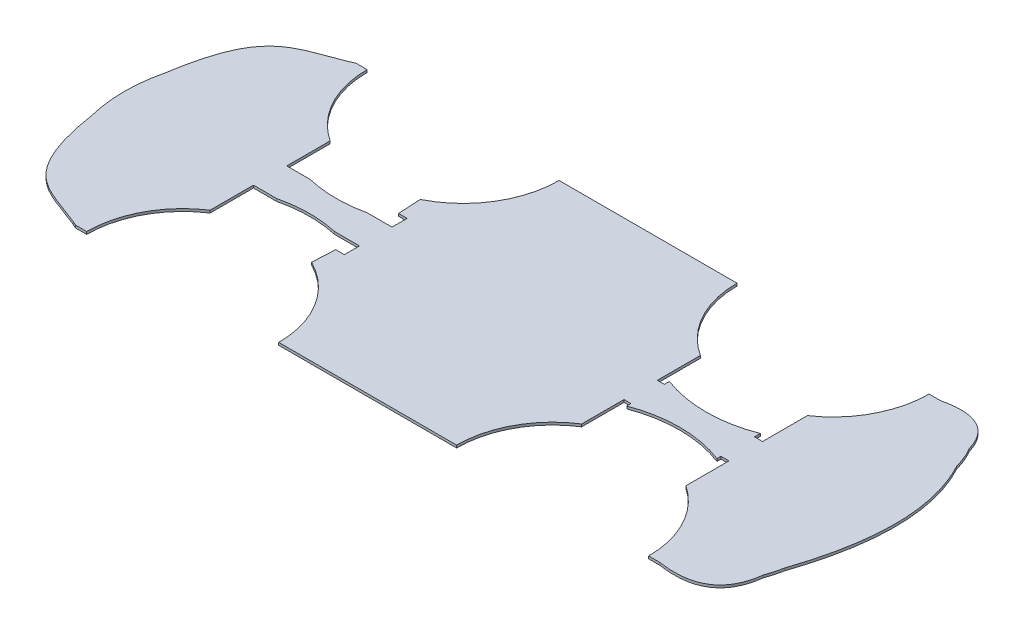
from build123d import *

# Parameters (mm, degrees)
SKETCH1_W            = 581.25
SKETCH1_H            = 236.875
BOSS_EXTRUDE1_DEPTH  = 5
SKETCH2_W            = 581.25
SKETCH2_H            = 5
BOSS_EXTRUDE2_DEPTH  = 41.35
CUT_EXTRUDE4_DEPTH   = 628.683302411
SKETCH4_W            = 290.625
SKETCH4_H            = 139.1125
CUT_EXTRUDE8_DEPTH   = 628.683302411
SKETCH7_W            = 0.7
SKETCH7_H            = 139.1125
CUT_EXTRUDE9_DEPTH   = 590.435381451
BOSS_EXTRUDE8_START  = -5
BOSS_EXTRUDE8_DEPTH  = 5
CUT_EXTRUDE14_START  = -6
CUT_EXTRUDE14_DEPTH  = 7
SKETCH10_W           = 88.237732613
SKETCH10_H           = 139.1125
CUT_EXTRUDE15_DEPTH  = 690.954958212
CUT_EXTRUDE16_DEPTH  = 694.925451462
CUT_EXTRUDE17_DEPTH  = 694.925451462
CUT_EXTRUDE18_DEPTH  = 694.925451462
CUT_EXTRUDE19_DEPTH  = 694.925451462
BOSS_EXTRUDE10_DEPTH = 5
BOSS_EXTRUDE13_START = -5
BOSS_EXTRUDE13_DEPTH = 5
CUT_EXTRUDE24_START  = -10
CUT_EXTRUDE24_DEPTH  = 10
BOSS_EXTRUDE16_DEPTH = 5
BOSS_EXTRUDE19_DEPTH = 5
BOSS_EXTRUDE20_START = -5
BOSS_EXTRUDE20_DEPTH = 5
BOSS_EXTRUDE21_START = -5
BOSS_EXTRUDE21_DEPTH = 5
BOSS_EXTRUDE22_START = -5
BOSS_EXTRUDE22_DEPTH = 5
BOSS_EXTRUDE23_START = -5
BOSS_EXTRUDE23_DEPTH = 5
CUT_EXTRUDE25_START  = -6
CUT_EXTRUDE25_DEPTH  = 7
SKETCH29_W           = 5
SKETCH29_H           = 5
CUT_EXTRUDE26_DEPTH  = 20
CUT_EXTRUDE27_START  = -6
CUT_EXTRUDE27_DEPTH  = 7
CUT_EXTRUDE28_START  = -6
CUT_EXTRUDE28_DEPTH  = 7
CUT_EXTRUDE29_DEPTH  = 2.5


with BuildPart() as part:
    # Sketch1 → Boss-Extrude1 (new body)
    with BuildSketch(Plane(origin=(0, 0, 0), x_dir=(1, 0, 0), z_dir=(0, 1, 0))):
        with Locations((290.625, 118.4375)):
            Rectangle(SKETCH1_W, SKETCH1_H)
    extrude(amount=BOSS_EXTRUDE1_DEPTH)

    # Sketch2 → Boss-Extrude2 (add)
    with BuildSketch(Plane.XY):
        with Locations((290.625, 2.5)):
            Rectangle(SKETCH2_W, SKETCH2_H)
    extrude(amount=BOSS_EXTRUDE2_DEPTH)

    # Sketch3 → Cut-Extrude4 (cut, through all)
    with BuildSketch(Plane(origin=(0, 5, 0), x_dir=(1, 0, 0), z_dir=(0, 1, 0))):
        with BuildLine():
            Line((561.288662792, -1.35), (388.367199859, -1.35))
            ThreePointArc((388.367199859, -1.35), (387.060651643, -4.30458594), (385.855034537, -7.301773574))
            Line((385.855034537, -7.301773574), (423.825, -41.35))
            Line((423.825, -41.35), (474.827931326, -41.35))
            Line((474.827931326, -41.35), (525.825, -41.35))
            Line((525.825, -41.35), (564.419690988, -8.965209027))
            ThreePointArc((564.419690988, -8.965209027), (562.936488006, -5.12376192), (561.288662792, -1.35))
        make_face()
        with BuildLine():
            Line((475.714581985, 20.289198365), (402.191388797, 20.289198365))
            ThreePointArc((402.191388797, 20.289198365), (394.546866468, 9.937510283), (388.367199859, -1.35))
            Line((388.367199859, -1.35), (561.288662792, -1.35))
            ThreePointArc((561.288662792, -1.35), (555.108996184, 9.937510283), (547.464473855, 20.289198365))
            Line((547.464473855, 20.289198365), (475.714581985, 20.289198365))
        make_face()
        with BuildLine():
            ThreePointArc((547.464473855, 20.289198365), (474.827931326, 53.915198712), (402.191388797, 20.289198365))
            Line((402.191388797, 20.289198365), (475.714581985, 20.289198365))
            Line((475.714581985, 20.289198365), (547.464473855, 20.289198365))
        make_face()
        with BuildLine():
            ThreePointArc((385.855034537, -7.301773574), (381.149014866, -24.037614359), (379.562732613, -41.35))
            Line((379.562732613, -41.35), (404.745509672, -41.35))
            Line((404.745509672, -41.35), (423.825, -41.35))
            Line((423.825, -41.35), (385.855034537, -7.301773574))
        make_face()
        with BuildLine():
            Line((546.683654297, -41.35), (570.093130038, -41.35))
            ThreePointArc((570.093130038, -41.35), (568.664051431, -24.911002182), (564.419690988, -8.965209027))
            Line((564.419690988, -8.965209027), (525.825, -41.35))
            Line((525.825, -41.35), (546.683654297, -41.35))
        make_face()
    extrude(amount=-CUT_EXTRUDE4_DEPTH, mode=Mode.SUBTRACT)

    # Sketch4 → Cut-Extrude8 (cut, through all)
    with BuildSketch(Plane(origin=(0, 5, 0), x_dir=(1, 0, 0), z_dir=(0, 1, 0))):
        with Locations((435.9375, 167.31875)):
            Rectangle(SKETCH4_W, SKETCH4_H)
        with Locations((145.3125, 28.20625)):
            Rectangle(SKETCH4_W, SKETCH4_H)
        with Locations((145.3125, 167.31875)):
            Rectangle(SKETCH4_W, SKETCH4_H)
    extrude(amount=-CUT_EXTRUDE8_DEPTH, mode=Mode.SUBTRACT)

    # Sketch7 → Cut-Extrude9 (cut, through all)
    with BuildSketch(Plane(origin=(0, 5, 0), x_dir=(1, 0, 0), z_dir=(0, 1, 0))):
        with Locations((290.975, 28.20625)):
            Rectangle(SKETCH7_W, SKETCH7_H)
    extrude(amount=-CUT_EXTRUDE9_DEPTH, mode=Mode.SUBTRACT)

    # Mirror11: part across plane


with BuildPart() as part_1:
    add(part.part)
    add(part.part.mirror(Plane(origin=(0, 0, -97.7625), x_dir=(1, 0, 0), z_dir=(0, 0, -1))))

    # Mirror12: part across plane


with BuildPart() as part_2:
    add(part_1.part)
    add(part_1.part.mirror(Plane.ZY.offset(-291.325)))

    # Boss-Extrude8: read off the stored shape, not the designer's step
    # Boss-Extrude8 outline → Boss-Extrude8 (add)
    with BuildSketch(Plane(origin=(0, 5, 0), x_dir=(1, 0, 0), z_dir=(0, 1, 0)).offset(BOSS_EXTRUDE8_START)):
        with BuildLine():
            Line((581.25, 236.875), (581.25, -41.35))
            ThreePointArc((581.25, -41.35), (647.999289148, 97.7625), (581.25, 236.875))
        make_face()
        with BuildLine():
            Line((1.4, -41.35), (1.4, 236.875))
            ThreePointArc((1.4, 236.875), (-69.575242199, 97.7625), (1.4, -41.35))
        make_face()
    extrude(amount=BOSS_EXTRUDE8_DEPTH)

    # Cut-Extrude14: read off the stored shape, not the designer's step
    # Cut-Extrude14 outline → Cut-Extrude14 (cut)
    with BuildSketch(Plane(origin=(0, 0, 0), x_dir=(-1, 0, 0), z_dir=(0, -1, 0)).offset(CUT_EXTRUDE14_START)):
        with BuildLine():
            ThreePointArc((-62.383549112, 76.236492902), (-107.27373879, 84.709278545), (-152.235937883, 76.627330852))
            ThreePointArc((-152.235937883, 76.627330852), (-150.454986439, 61.039222908), (-143.430617126, 47.009998658))
            ThreePointArc((-143.430617126, 47.009998658), (-107.407690123, 53.914297489), (-71.446189441, 46.696882373))
            ThreePointArc((-71.446189441, 46.696882373), (-64.300040219, 60.664468013), (-62.383549112, 76.236492902))
        make_face()
    extrude(amount=CUT_EXTRUDE14_DEPTH, mode=Mode.SUBTRACT)

    # Sketch10 → Cut-Extrude15 (cut, through all)
    with BuildSketch(Plane(origin=(0, 0, 0), x_dir=(-1, 0, 0), z_dir=(0, -1, 0))):
        with Locations((-335.443866307, 28.20625)):
            Rectangle(SKETCH10_W, SKETCH10_H)
        with BuildLine():
            ThreePointArc((-570.093130038, -41.35), (-474.827931326, 53.915198712), (-379.562732613, -41.35))
            Line((-379.562732613, -41.35), (-379.562732613, 97.7625))
            Line((-379.562732613, 97.7625), (-647.999289148, 97.7625))
            ThreePointArc((-647.999289148, 97.7625), (-630.448332788, 20.613690453), (-581.25, -41.35))
            Line((-581.25, -41.35), (-570.093130038, -41.35))
        make_face()
        with Locations((-335.443866307, 167.31875)):
            Rectangle(SKETCH10_W, SKETCH10_H)
        with BuildLine():
            Line((-291.325, 236.875), (-291.325, 97.7625))
            Line((-291.325, 97.7625), (69.575242199, 97.7625))
            ThreePointArc((69.575242199, 97.7625), (50.80630243, 175.848626587), (-1.4, 236.875))
            Line((-1.4, 236.875), (-12.556869962, 236.875))
            ThreePointArc((-12.556869962, 236.875), (-107.822068674, 141.609801288), (-203.087267387, 236.875))
            Line((-203.087267387, 236.875), (-291.325, 236.875))
        make_face()
        with BuildLine():
            Line((-647.999289148, 97.7625), (-379.562732613, 97.7625))
            Line((-379.562732613, 97.7625), (-379.562732613, 236.875))
            ThreePointArc((-379.562732613, 236.875), (-474.827931326, 141.609801288), (-570.093130038, 236.875))
            Line((-570.093130038, 236.875), (-581.25, 236.875))
            ThreePointArc((-581.25, 236.875), (-630.448332788, 174.911309547), (-647.999289148, 97.7625))
        make_face()
    extrude(amount=-CUT_EXTRUDE15_DEPTH, mode=Mode.SUBTRACT)

    # Mirror13: part across plane


with BuildPart() as part_3:
    add(part_2.part)
    add(part_2.part.mirror(Plane(origin=(0, 0, -97.7625), x_dir=(1, 0, 0), z_dir=(0, 0, -1))))

    # Mirror14: part across plane


with BuildPart() as part_4:
    add(part_3.part)
    add(part_3.part.mirror(Plane.ZY.offset(-291.325)))

    # Sketch11 → Cut-Extrude16 (cut, through all)
    with BuildSketch(Plane(origin=(0, 0, 0), x_dir=(-1, 0, 0), z_dir=(0, -1, 0))):
        Polygon((-430.414062117, 118.897669148), (-432.166884114, 151.69581747), (-517.488978538, 151.69581747), (-520.266450888, 119.288507098), align=None)
    extrude(amount=-CUT_EXTRUDE16_DEPTH, mode=Mode.SUBTRACT)

    # Sketch12 → Cut-Extrude17 (cut, through all)
    with BuildSketch(Plane(origin=(0, 0, 0), x_dir=(-1, 0, 0), z_dir=(0, -1, 0))):
        with BuildLine():
            Line((-291.325, -41.35), (-291.325, 97.7625))
            Line((-291.325, 97.7625), (-652.225242199, 97.7625))
            ThreePointArc((-652.225242199, 97.7625), (-633.45630243, 19.676373413), (-581.25, -41.35))
            Line((-581.25, -41.35), (-570.093130038, -41.35))
            ThreePointArc((-570.093130038, -41.35), (-554.01383111, 11.612735589), (-511.203810559, 46.696882374))
            ThreePointArc((-511.203810559, 46.696882374), (-518.349959781, 60.664468013), (-520.266450888, 76.236492902))
            ThreePointArc((-520.266450888, 76.236492902), (-475.37626121, 84.709278545), (-430.414062117, 76.627330852))
            ThreePointArc((-430.414062117, 76.627330852), (-432.195013561, 61.039222908), (-439.219382874, 47.009998658))
            ThreePointArc((-439.219382874, 47.009998658), (-395.873154619, 11.956672385), (-379.562732613, -41.35))
            Line((-379.562732613, -41.35), (-291.325, -41.35))
        make_face()
        with BuildLine():
            Line((-203.087267387, 236.875), (-291.325, 236.875))
            Line((-291.325, 236.875), (-291.325, 97.7625))
            Line((-291.325, 97.7625), (-291.325, -41.35))
            Line((-291.325, -41.35), (-203.087267387, -41.35))
            ThreePointArc((-203.087267387, -41.35), (-186.776845381, 11.956672385), (-143.430617126, 47.009998658))
            ThreePointArc((-143.430617126, 47.009998658), (-150.454986439, 61.039222908), (-152.235937883, 76.627330852))
            ThreePointArc((-152.235937883, 76.627330852), (-107.27373879, 84.709278545), (-62.383549112, 76.236492902))
            ThreePointArc((-62.383549112, 76.236492902), (-64.300040219, 60.664468013), (-71.446189441, 46.696882374))
            ThreePointArc((-71.446189441, 46.696882374), (-28.63616889, 11.612735589), (-12.556869962, -41.35))
            Line((-12.556869962, -41.35), (-1.4, -41.35))
            ThreePointArc((-1.4, -41.35), (69.575242199, 97.7625), (-1.4, 236.875))
            Line((-1.4, 236.875), (-12.556869962, 236.875))
            ThreePointArc((-12.556869962, 236.875), (-28.63616889, 183.912264411), (-71.446189441, 148.828117626))
            ThreePointArc((-71.446189441, 148.828117626), (-64.300040219, 134.860531987), (-62.383549112, 119.288507098))
            ThreePointArc((-62.383549112, 119.288507098), (-107.27373879, 110.815721455), (-152.235937883, 118.897669148))
            ThreePointArc((-152.235937883, 118.897669148), (-150.454986439, 134.485777092), (-143.430617126, 148.515001342))
            ThreePointArc((-143.430617126, 148.515001342), (-186.776845381, 183.568327615), (-203.087267387, 236.875))
        make_face()
    extrude(amount=-CUT_EXTRUDE17_DEPTH, mode=Mode.SUBTRACT)

    # Mirror15: part across plane


with BuildPart() as part_5:
    add(part_4.part)
    add(part_4.part.mirror(Plane(origin=(0, 0, -97.7625), x_dir=(1, 0, 0), z_dir=(0, 0, -1))))

    # Mirror16: part across plane


with BuildPart() as part_6:
    add(part_5.part)
    add(part_5.part.mirror(Plane.ZY.offset(-291.325)))

    # Sketch13 → Cut-Extrude18 (cut, through all)
    with BuildSketch(Plane(origin=(0, 0, 0), x_dir=(-1, 0, 0), z_dir=(0, -1, 0))):
        with BuildLine():
            Line((-291.325, 97.7625), (-410.414062117, 97.7625))
            Line((-410.414062117, 97.7625), (-410.414062117, 53.917273781))
            ThreePointArc((-410.414062117, 53.917273781), (-378.354190748, 21.242470624), (-361.580414797, -21.35))
            Line((-361.580414797, -21.35), (-291.325, -21.35))
            Line((-291.325, -21.35), (-291.325, 97.7625))
        make_face()
        with BuildLine():
            Line((-172.235937883, 97.7625), (-291.325, 97.7625))
            Line((-291.325, 97.7625), (-291.325, -21.35))
            Line((-291.325, -21.35), (-221.069588325, -21.35))
            ThreePointArc((-221.069588325, -21.35), (-204.295811413, 21.242472942), (-172.235937883, 53.917277491))
            Line((-172.235937883, 53.917277491), (-172.235937883, 97.7625))
        make_face()
        with BuildLine():
            Line((-221.069585203, 216.875), (-291.325, 216.875))
            Line((-291.325, 216.875), (-291.325, 97.7625))
            Line((-291.325, 97.7625), (-172.235937883, 97.7625))
            Line((-172.235937883, 97.7625), (-172.235937883, 118.897669148))
            Line((-172.235937883, 118.897669148), (-172.235937883, 141.607726219))
            ThreePointArc((-172.235937883, 141.607726219), (-204.295809252, 174.282529376), (-221.069585203, 216.875))
        make_face()
        with BuildLine():
            ThreePointArc((-361.580414797, 216.875), (-378.354190748, 174.282529376), (-410.414062117, 141.607726219))
            Line((-410.414062117, 141.607726219), (-410.414062117, 118.897669148))
            Line((-410.414062117, 118.897669148), (-410.414062117, 97.7625))
            Line((-410.414062117, 97.7625), (-291.325, 97.7625))
            Line((-291.325, 97.7625), (-291.325, 216.875))
            Line((-291.325, 216.875), (-361.580414797, 216.875))
        make_face()
    extrude(amount=-CUT_EXTRUDE18_DEPTH, mode=Mode.SUBTRACT)

    # Sketch14 → Cut-Extrude19 (cut, through all)
    with BuildSketch(Plane(origin=(0, 0, 0), x_dir=(-1, 0, 0), z_dir=(0, -1, 0))):
        with BuildLine():
            Line((-40.388084106, 143.721053625), (-40.388084106, 51.803946375))
            ThreePointArc((-40.388084106, 51.803946375), (-13.737445325, 24.77929494), (2.664633102, -9.448766003))
            ThreePointArc((2.664633102, -9.448766003), (47.756366307, 97.7625), (2.664633102, 204.973766003))
            ThreePointArc((2.664633102, 204.973766003), (-13.737445325, 170.74570506), (-40.388084106, 143.721053625))
        make_face()
        with BuildLine():
            ThreePointArc((-585.314633102, -9.448766003), (-567.874103892, 26.232614412), (-539.336047613, 53.853481728))
            Line((-539.336047613, 53.853481728), (-539.336047613, 141.671518272))
            ThreePointArc((-539.336047613, 141.671518272), (-567.874103892, 169.292385588), (-585.314633102, 204.973766003))
            ThreePointArc((-585.314633102, 204.973766003), (-630.406366307, 97.7625), (-585.314633102, -9.448766003))
        make_face()
    extrude(amount=-CUT_EXTRUDE19_DEPTH, mode=Mode.SUBTRACT)

    # Sketch16 → Boss-Extrude10 (add)
    with BuildSketch(Plane(origin=(0, 0, 0), x_dir=(-1, 0, 0), z_dir=(0, -1, 0))):
        with BuildLine():
            ThreePointArc((-1.4, -41.35), (64.518075725, 14.769312621), (89.149372992, 97.7625))
            ThreePointArc((89.149372992, 97.7625), (64.518075725, 180.755687379), (-1.4, 236.875))
            ThreePointArc((-1.4, 236.875), (50.80630243, 175.848626587), (69.575242199, 97.7625))
            ThreePointArc((69.575242199, 97.7625), (50.80630243, 19.676373413), (-1.4, -41.35))
        make_face()
    extrude(amount=-BOSS_EXTRUDE10_DEPTH)

    # Sketch17 → Boss-Extrude13 (add)
    with BuildSketch(Plane(origin=(0, 5, 0), x_dir=(1, 0, 0), z_dir=(0, 1, 0)).offset(BOSS_EXTRUDE13_START)):
        with BuildLine():
            ThreePointArc((-2.418953025, -39.595853312), (-55.007674407, 1.727890787), (-84.79194329, 61.612135543))
            add(Edge.make_bspline(
                [(-84.79194329, 61.612135543), (-71.024821611, -26.233461716), (-42.710841679, -22.438648913), (-2.418953025, -39.595853312)],
                knots=[0.103259306, 0.103259306, 0.103259306, 0.103259306, 0.955846494, 0.955846494, 0.955846494, 0.955846494], degree=3))
        make_face()
    extrude(amount=BOSS_EXTRUDE13_DEPTH)

    # Sketch19 → Cut-Extrude24 (cut)
    with BuildSketch(Plane(origin=(0, 0, 0), x_dir=(-1, 0, 0), z_dir=(0, -1, 0)).offset(CUT_EXTRUDE24_START)):
        with BuildLine():
            Line((-65.161021462, 151.69581747), (-63.442753977, 131.647219073))
            ThreePointArc((-63.442753977, 131.647219073), (-62.485283036, 125.504533607), (-62.383549112, 119.288507098))
            ThreePointArc((-62.383549112, 119.288507098), (-107.27373879, 110.815721455), (-152.235937883, 118.897669148))
            ThreePointArc((-152.235937883, 118.897669148), (-152.256791769, 124.063385309), (-151.685489392, 129.197455033))
            Line((-151.685489392, 129.197455033), (-150.483115886, 151.69581747))
            ThreePointArc((-150.483115886, 151.69581747), (-188.876282709, 186.818307412), (-203.087267387, 236.875))
            Line((-203.087267387, 236.875), (-379.562732613, 236.875))
            ThreePointArc((-379.562732613, 236.875), (-393.773717291, 186.818307412), (-432.166884114, 151.69581747))
            Line((-432.166884114, 151.69581747), (-430.964510608, 129.197455033))
            ThreePointArc((-430.964510608, 129.197455033), (-430.393208231, 124.063385309), (-430.414062117, 118.897669148))
            ThreePointArc((-430.414062117, 118.897669148), (-475.37626121, 110.815721455), (-520.266450888, 119.288507098))
            ThreePointArc((-520.266450888, 119.288507098), (-520.164716964, 125.504533607), (-519.207246023, 131.647219073))
            Line((-519.207246023, 131.647219073), (-517.488978538, 151.69581747))
            ThreePointArc((-517.488978538, 151.69581747), (-555.882145361, 186.818307412), (-570.093130038, 236.875))
            Line((-570.093130038, 236.875), (-581.25, 236.875))
            ThreePointArc((-581.25, 236.875), (-633.45630243, 175.848626587), (-652.225242199, 97.7625))
            Line((-652.225242199, 97.7625), (-630.406366307, 97.7625))
            ThreePointArc((-630.406366307, 97.7625), (-618.674656271, 155.916433576), (-585.314633102, 204.973766003))
            ThreePointArc((-585.314633102, 204.973766003), (-567.874103892, 169.292385588), (-539.336047613, 141.671518272))
            Line((-539.336047613, 141.671518272), (-539.336047613, 97.7625))
            Line((-539.336047613, 97.7625), (-410.414062117, 97.7625))
            Line((-410.414062117, 97.7625), (-410.414062117, 141.607726219))
            ThreePointArc((-410.414062117, 141.607726219), (-378.354190748, 174.282529376), (-361.580414797, 216.875))
            Line((-361.580414797, 216.875), (-221.069585203, 216.875))
            ThreePointArc((-221.069585203, 216.875), (-204.295809252, 174.282529376), (-172.235937883, 141.607726219))
            Line((-172.235937883, 141.607726219), (-172.235937883, 97.7625))
            Line((-172.235937883, 97.7625), (-40.388084106, 97.7625))
            Line((-40.388084106, 97.7625), (-40.388084106, 143.721053625))
            ThreePointArc((-40.388084106, 143.721053625), (-13.737445325, 170.74570506), (2.664633102, 204.973766003))
            ThreePointArc((2.664633102, 204.973766003), (36.024656271, 155.916433576), (47.756366307, 97.7625))
            Line((47.756366307, 97.7625), (89.149372992, 97.7625))
            ThreePointArc((89.149372992, 97.7625), (64.518075725, 180.755687379), (-1.4, 236.875))
            Line((-1.4, 236.875), (-12.556869962, 236.875))
            ThreePointArc((-12.556869962, 236.875), (-26.767854639, 186.818307412), (-65.161021462, 151.69581747))
        make_face()
    extrude(amount=CUT_EXTRUDE24_DEPTH, mode=Mode.SUBTRACT)

    # Sketch20 → Boss-Extrude16 (add)
    with BuildSketch(Plane(origin=(0, 0, 0), x_dir=(-1, 0, 0), z_dir=(0, -1, 0))):
        with BuildLine():
            add(Edge.make_bspline(
                [(-652.225242199, 97.7625), (-653.276408493, 19.862053438), (-651.161739959, -40.874176183), (-581.25, -41.35)],
                knots=[0, 0, 0, 0, 1, 1, 1, 1], degree=3))
            ThreePointArc((-581.25, -41.35), (-633.45630243, 19.676373413), (-652.225242199, 97.7625))
        make_face()
    extrude(amount=-BOSS_EXTRUDE16_DEPTH)

    # Mirror22: part across plane


with BuildPart() as part_7:
    add(part_6.part)
    add(part_6.part.mirror(Plane(origin=(0, 0, -97.7625), x_dir=(1, 0, 0), z_dir=(0, 0, -1))))

    # Sketch21 → Boss-Extrude19 (add)
    with BuildSketch(Plane(origin=(0, 0, 0), x_dir=(-1, 0, 0), z_dir=(0, -1, 0))):
        with BuildLine():
            add(Edge.make_bspline(
                [(-645.850413767, 188.505538632), (-682.808090785, 119.519608735), (-647.995540446, 16.089365279)],
                knots=[0, 0, 0, 1, 1, 1], degree=2))
            add(Edge.make_bspline(
                [(-652.225242199, 97.7625), (-652.640764666, 66.968717945), (-652.561595664, 38.857006232), (-647.995540446, 16.089365279)],
                knots=[0, 0, 0, 0, 0.395296605, 0.395296605, 0.395296605, 0.395296605], degree=3))
            add(Edge.make_bspline(
                [(-645.850413767, 188.505538632), (-652.530525528, 164.337806246), (-652.697822618, 132.784766103), (-652.225242199, 97.7625)],
                knots=[0.550422781, 0.550422781, 0.550422781, 0.550422781, 1, 1, 1, 1], degree=3))
        make_face()
        with BuildLine():
            add(Edge.make_bspline(
                [(-581.25, -41.35), (-637.213118982, -49.924151127), (-643.335994579, -0.862731816)],
                knots=[0, 0, 0, 1, 1, 1], degree=2))
            add(Edge.make_bspline(
                [(-643.335994579, -0.862731816), (-634.195767532, -25.823264869), (-616.189659387, -41.112198422), (-581.25, -41.35)],
                knots=[0.500231872, 0.500231872, 0.500231872, 0.500231872, 1, 1, 1, 1], degree=3))
        make_face()
        with BuildLine():
            add(Edge.make_bspline(
                [(-581.25, 236.875), (-626.290038244, 247.465157349), (-637.006425589, 209.701862076)],
                knots=[0, 0, 0, 1, 1, 1], degree=2))
            add(Edge.make_bspline(
                [(-581.25, 236.875), (-609.456590601, 236.683024123), (-626.627175843, 226.681861102), (-637.006425589, 209.701862076)],
                knots=[0, 0, 0, 0, 0.40346, 0.40346, 0.40346, 0.40346], degree=3))
        make_face()
    extrude(amount=-BOSS_EXTRUDE19_DEPTH)

    # Sketch23 → Boss-Extrude20 (add)
    with BuildSketch(Plane(origin=(0, 5, 0), x_dir=(1, 0, 0), z_dir=(0, 1, 0)).offset(BOSS_EXTRUDE20_START)):
        with BuildLine():
            ThreePointArc((410.414062117, 141.607726219), (378.354190748, 174.282529376), (361.580414797, 216.875))
            Line((361.580414797, 216.875), (223.337256348, 216.875))
            ThreePointArc((223.337256348, 216.875), (205.689420754, 173.285220421), (172.235937883, 140.234056015))
            Line((172.235937883, 140.234056015), (172.235937883, 53.917277491))
            ThreePointArc((172.235937883, 53.917277491), (204.295811623, 21.242473078), (221.069588325, -21.35))
            Line((221.069588325, -21.35), (361.580414797, -21.35))
            ThreePointArc((361.580414797, -21.35), (378.354190748, 21.242470624), (410.414062117, 53.917273781))
            Line((410.414062117, 53.917273781), (410.414062117, 141.607726219))
        make_face()
    extrude(amount=BOSS_EXTRUDE20_DEPTH)

    # Sketch24 → Boss-Extrude21 (add)
    with BuildSketch(Plane(origin=(0, 5, 0), x_dir=(1, 0, 0), z_dir=(0, 1, 0)).offset(BOSS_EXTRUDE21_START)):
        with BuildLine():
            ThreePointArc((-2.664633102, -9.448766003), (13.737445325, 24.77929494), (40.388084106, 51.803946375))
            Line((40.388084106, 51.803946375), (40.388084106, 143.721053625))
            ThreePointArc((40.388084106, 143.721053625), (13.737445325, 170.74570506), (-2.664633102, 204.973766003))
            ThreePointArc((-2.664633102, 204.973766003), (-47.756366307, 97.7625), (-2.664633102, -9.448766003))
        make_face()
    extrude(amount=BOSS_EXTRUDE21_DEPTH)

    # Sketch26 → Boss-Extrude22 (add)
    with BuildSketch(Plane(origin=(0, 5, 0), x_dir=(1, 0, 0), z_dir=(0, 1, 0)).offset(BOSS_EXTRUDE22_START)):
        with BuildLine():
            Line((539.336047613, 141.671518272), (539.336047613, 53.853481728))
            ThreePointArc((539.336047613, 53.853481728), (567.874103892, 26.232614412), (585.314633102, -9.448766003))
            ThreePointArc((585.314633102, -9.448766003), (618.674656271, 39.608566424), (630.406366307, 97.7625))
            ThreePointArc((630.406366307, 97.7625), (618.674656271, 155.916433576), (585.314633102, 204.973766003))
            ThreePointArc((585.314633102, 204.973766003), (570.82517446, 173.554155796), (547.645977736, 147.866393018))
            ThreePointArc((547.645977736, 147.866393018), (543.5608409, 144.675286652), (539.336047613, 141.671518272))
        make_face()
    extrude(amount=BOSS_EXTRUDE22_DEPTH)

    # Sketch27 → Boss-Extrude23 (add)
    with BuildSketch(Plane(origin=(0, 5, 0), x_dir=(1, 0, 0), z_dir=(0, 1, 0)).offset(BOSS_EXTRUDE23_START)):
        with BuildLine():
            ThreePointArc((223.337256348, 216.875), (205.689420754, 173.285220421), (172.235937883, 140.234056015))
            Line((172.235937883, 140.234056015), (172.235937883, 141.607722509))
            ThreePointArc((172.235937883, 141.607722509), (204.295811413, 174.282527058), (221.069588325, 216.875))
            Line((221.069588325, 216.875), (223.337256348, 216.875))
        make_face()
    extrude(amount=BOSS_EXTRUDE23_DEPTH)

    # Cut-Extrude25: read off the stored shape, not the designer's step
    # Cut-Extrude25 outline → Cut-Extrude25 (cut)
    with BuildSketch(Plane.XZ.offset(CUT_EXTRUDE25_START)):
        with BuildLine():
            Line((520.266450888, -76.236492902), (520.351430222, -80.193020519))
            Line((520.351430222, -80.193020519), (528.266450888, -80.193020519))
            Line((528.266450888, -80.193020519), (528.266450888, -37.515599045))
            ThreePointArc((528.266450888, -37.515599045), (522.981301069, -40.849215739), (517.488978538, -43.82918253))
            Line((517.488978538, -43.82918253), (519.207246023, -63.877780926))
            ThreePointArc((519.207246023, -63.877780926), (520.164716964, -70.020466393), (520.266450888, -76.236492902))
        make_face()
        with BuildLine():
            ThreePointArc((517.488978538, -151.69581747), (522.981301069, -154.675784261), (528.266450888, -158.009400955))
            Line((528.266450888, -158.009400955), (528.266450888, -113.506831199))
            Line((528.266450888, -113.506831199), (520.266450888, -113.506831199))
            Line((520.266450888, -113.506831199), (520.266450888, -119.288507098))
            ThreePointArc((520.266450888, -119.288507098), (520.164716964, -125.504533607), (519.207246023, -131.647219074))
            Line((519.207246023, -131.647219074), (517.488978538, -151.69581747))
        make_face()
        with BuildLine():
            Line((62.383549112, -119.288507098), (62.383549112, -114.288507098))
            Line((62.383549112, -114.288507098), (55.442753977, -114.288507098))
            Line((55.442753977, -114.288507098), (55.442753977, -157.301980216))
            ThreePointArc((55.442753977, -157.301980216), (60.21928658, -154.355709997), (65.161021462, -151.69581747))
            Line((65.161021462, -151.69581747), (63.442753977, -131.647219074))
            ThreePointArc((63.442753977, -131.647219074), (62.485283036, -125.504533607), (62.383549112, -119.288507098))
        make_face()
        with BuildLine():
            Line((55.442753977, -38.223019784), (55.442753977, -81.236492902))
            Line((55.442753977, -81.236492902), (62.383549112, -81.236492902))
            Line((62.383549112, -81.236492902), (62.383549112, -76.236492902))
            ThreePointArc((62.383549112, -76.236492902), (62.485283036, -70.020466393), (63.442753977, -63.877780926))
            Line((63.442753977, -63.877780926), (65.161021462, -43.82918253))
            ThreePointArc((65.161021462, -43.82918253), (60.21928658, -41.169290003), (55.442753977, -38.223019784))
        make_face()
        with BuildLine():
            Line((430.414062117, -118.897669148), (430.414062117, -113.897669148))
            Line((430.414062117, -113.897669148), (423.473266982, -113.897669148))
            Line((423.473266982, -113.897669148), (423.473266982, -156.636876045))
            ThreePointArc((423.473266982, -156.636876045), (427.755200156, -154.052200809), (432.166884114, -151.69581747))
            Line((432.166884114, -151.69581747), (430.964510608, -129.197455029))
            ThreePointArc((430.964510608, -129.197455029), (430.393208231, -124.063385307), (430.414062117, -118.897669148))
        make_face()
        with BuildLine():
            Line((423.473266982, -38.888123955), (423.473266982, -80.845654953))
            Line((423.473266982, -80.845654953), (430.414062117, -80.845654953))
            Line((430.414062117, -80.845654953), (430.414062117, -76.627330852))
            ThreePointArc((430.414062117, -76.627330852), (430.393208231, -71.461614693), (430.964510608, -66.327544971))
            Line((430.964510608, -66.327544971), (432.166884114, -43.82918253))
            ThreePointArc((432.166884114, -43.82918253), (427.755200156, -41.472799191), (423.473266982, -38.888123955))
        make_face()
    extrude(amount=CUT_EXTRUDE25_DEPTH, mode=Mode.SUBTRACT)

    # Sketch29 → Cut-Extrude26 (cut)
    with BuildSketch(Plane.ZY.offset(-62.383549112)):
        with Locations((-116.788507098, 2.5)):
            Rectangle(SKETCH29_W, SKETCH29_H)
        with Locations((-78.736492902, 2.5)):
            Rectangle(SKETCH29_W, SKETCH29_H)
    extrude(amount=-CUT_EXTRUDE26_DEPTH, mode=Mode.SUBTRACT)

    # Cut-Extrude27: read off the stored shape, not the designer's step
    # Cut-Extrude27 outline → Cut-Extrude27 (cut)
    with BuildSketch(Plane(origin=(0, 5, 0), x_dir=(1, 0, 0), z_dir=(0, 1, 0)).offset(CUT_EXTRUDE27_START)):
        with BuildLine():
            Line((135.531606194, 113.897669148), (152.235937883, 113.897669148))
            Line((152.235937883, 113.897669148), (152.235937883, 118.897669148))
            ThreePointArc((152.235937883, 118.897669148), (143.970325196, 116.108506619), (135.531606194, 113.897669148))
        make_face()
        with BuildLine():
            ThreePointArc((135.531606194, 81.627330852), (143.970325196, 79.416493381), (152.235937883, 76.627330852))
            Line((152.235937883, 76.627330852), (152.235937883, 81.627330852))
            Line((152.235937883, 81.627330852), (135.531606194, 81.627330852))
        make_face()
    extrude(amount=CUT_EXTRUDE27_DEPTH, mode=Mode.SUBTRACT)

    # Cut-Extrude28: read off the stored shape, not the designer's step
    # Cut-Extrude28 outline → Cut-Extrude28 (cut)
    with BuildSketch(Plane(origin=(0, 0, 0), x_dir=(-1, 0, 0), z_dir=(0, -1, 0)).offset(CUT_EXTRUDE28_START)):
        with BuildLine():
            Line((-160.235937883, 113.897669148), (-152.235937883, 113.897669148))
            Line((-152.235937883, 113.897669148), (-152.235937883, 118.897669148))
            ThreePointArc((-152.235937883, 118.897669148), (-152.264644817, 123.911634602), (-151.735368745, 128.897669148))
            Line((-151.735368745, 128.897669148), (-160.235937883, 128.897669148))
            Line((-160.235937883, 128.897669148), (-160.235937883, 113.897669148))
        make_face()
        with BuildLine():
            Line((-152.235937883, 76.627330852), (-152.235937883, 81.627330852))
            Line((-152.235937883, 81.627330852), (-160.235937883, 81.627330852))
            Line((-160.235937883, 81.627330852), (-160.235937883, 66.627330852))
            Line((-160.235937883, 66.627330852), (-151.735368745, 66.627330852))
            ThreePointArc((-151.735368745, 66.627330852), (-152.264644817, 71.613365398), (-152.235937883, 76.627330852))
        make_face()
    extrude(amount=CUT_EXTRUDE28_DEPTH, mode=Mode.SUBTRACT)

    # Sketch33 → Cut-Extrude29 (cut)
    with BuildSketch(Plane(origin=(0, 5, 0), x_dir=(1, 0, 0), z_dir=(0, 1, 0))):
        with BuildLine():
            Line((160.235937883, 128.897669148), (160.235937883, 113.897669148))
            Line((160.235937883, 113.897669148), (135.531606194, 113.897669148))
            ThreePointArc((135.531606194, 113.897669148), (106.959229137, 110.817481855), (78.431693873, 114.288507098))
            Line((78.431693873, 114.288507098), (55.442753977, 114.288507098))
            Line((55.442753977, 114.288507098), (55.442753977, 157.301980216))
            ThreePointArc((55.442753977, 157.301980216), (23.960921804, 191.678029622), (12.556869962, 236.875))
            Line((12.556869962, 236.875), (1.4, 236.875))
            ThreePointArc((1.4, 236.875), (-0.515533827, 236.011114037), (-2.418953025, 235.120853312))
            add(Edge.make_bspline(
                [(-2.418953025, 235.120853312), (-42.710841679, 217.963648913), (-71.024821611, 221.758461716), (-84.79194329, 133.912864457)],
                knots=[0.103259306, 0.103259306, 0.103259306, 0.103259306, 0.955846494, 0.955846494, 0.955846494, 0.955846494], degree=3))
            ThreePointArc((-84.79194329, 133.912864457), (-89.149372992, 97.7625), (-84.79194329, 61.612135543))
            add(Edge.make_bspline(
                [(-84.79194329, 61.612135543), (-71.024821611, -26.233461716), (-42.710841679, -22.438648913), (-2.418953025, -39.595853312)],
                knots=[0.103259306, 0.103259306, 0.103259306, 0.103259306, 0.955846494, 0.955846494, 0.955846494, 0.955846494], degree=3))
            ThreePointArc((-2.418953025, -39.595853312), (-0.515533827, -40.486114037), (1.4, -41.35))
            Line((1.4, -41.35), (12.556869962, -41.35))
            ThreePointArc((12.556869962, -41.35), (23.960921804, 3.846970378), (55.442753977, 38.223019784))
            Line((55.442753977, 38.223019784), (55.442753977, 81.236492902))
            Line((55.442753977, 81.236492902), (78.431693873, 81.236492902))
            ThreePointArc((78.431693873, 81.236492902), (106.959229137, 84.707518145), (135.531606194, 81.627330852))
            Line((135.531606194, 81.627330852), (160.235937883, 81.627330852))
            Line((160.235937883, 81.627330852), (160.235937883, 66.627330852))
            Line((160.235937883, 66.627330852), (151.735368745, 66.627330852))
            ThreePointArc((151.735368745, 66.627330852), (151.710682144, 66.477395804), (151.685489392, 66.327544971))
            Line((151.685489392, 66.327544971), (150.483115886, 43.82918253))
            ThreePointArc((150.483115886, 43.82918253), (188.876282709, 8.706692588), (203.087267387, -41.35))
            Line((203.087267387, -41.35), (379.562732613, -41.35))
            ThreePointArc((379.562732613, -41.35), (391.258288544, 4.383717223), (423.473266982, 38.888123955))
            Line((423.473266982, 38.888123955), (423.473266982, 80.845654953))
            Line((423.473266982, 80.845654953), (430.414062117, 80.845654953))
            Line((430.414062117, 80.845654953), (430.414062117, 76.627330852))
            ThreePointArc((430.414062117, 76.627330852), (475.37626121, 84.709278545), (520.266450888, 76.236492902))
            Line((520.266450888, 76.236492902), (520.351430222, 80.193020519))
            Line((520.351430222, 80.193020519), (528.266450888, 80.193020519))
            Line((528.266450888, 80.193020519), (528.266450888, 37.515599045))
            ThreePointArc((528.266450888, 37.515599045), (558.989351438, 3.285338583), (570.093130038, -41.35))
            Line((570.093130038, -41.35), (581.25, -41.35))
            add(Edge.make_bspline(
                [(581.25, -41.35), (637.213118983, -49.924151128), (643.335994579, -0.862731815)],
                knots=[0, 0, 0, 1, 1, 1], degree=2))
            add(Edge.make_bspline(
                [(643.335994579, -0.862731815), (645.255148911, 4.378179039), (646.783437386, 10.045477075), (647.995540446, 16.089365279)],
                knots=[0.395296605, 0.395296605, 0.395296605, 0.395296605, 0.500231872, 0.500231872, 0.500231872, 0.500231872], degree=3))
            add(Edge.make_bspline(
                [(647.995540446, 16.089365279), (682.808090785, 119.519608736), (645.850413766, 188.505538633)],
                knots=[0, 0, 0, 1, 1, 1], degree=2))
            add(Edge.make_bspline(
                [(645.850413766, 188.505538633), (643.666744837, 196.405754704), (640.787131014, 203.516793212), (637.006425589, 209.701862076)],
                knots=[0.449577219, 0.449577219, 0.449577219, 0.449577219, 0.59654, 0.59654, 0.59654, 0.59654], degree=3))
            add(Edge.make_bspline(
                [(637.006425589, 209.701862076), (626.290038236, 247.46515738), (581.249999927, 236.874999983)],
                knots=[0, 0, 0, 1, 1, 1], degree=2))
            Line((581.249999927, 236.874999983), (570.093130038, 236.875))
            ThreePointArc((570.093130038, 236.875), (558.989351438, 192.239661417), (528.266450888, 158.009400955))
            Line((528.266450888, 158.009400955), (528.266450888, 113.506831199))
            Line((528.266450888, 113.506831199), (520.266450888, 113.506831199))
            Line((520.266450888, 113.506831199), (520.266450888, 119.288507098))
            ThreePointArc((520.266450888, 119.288507098), (475.37626121, 110.815721455), (430.414062117, 118.897669148))
            Line((430.414062117, 118.897669148), (430.414062117, 113.897669148))
            Line((430.414062117, 113.897669148), (423.473266982, 113.897669148))
            Line((423.473266982, 113.897669148), (423.473266982, 156.636876045))
            ThreePointArc((423.473266982, 156.636876045), (391.258288544, 191.141282777), (379.562732613, 236.875))
            Line((379.562732613, 236.875), (203.087267387, 236.875))
            ThreePointArc((203.087267387, 236.875), (188.876282709, 186.818307412), (150.483115886, 151.69581747))
            Line((150.483115886, 151.69581747), (151.685489392, 129.197455029))
            ThreePointArc((151.685489392, 129.197455029), (151.710682144, 129.047604196), (151.735368745, 128.897669148))
            Line((151.735368745, 128.897669148), (160.235937883, 128.897669148))
        make_face()
    extrude(amount=-CUT_EXTRUDE29_DEPTH, mode=Mode.SUBTRACT)


solid = part_7.part
